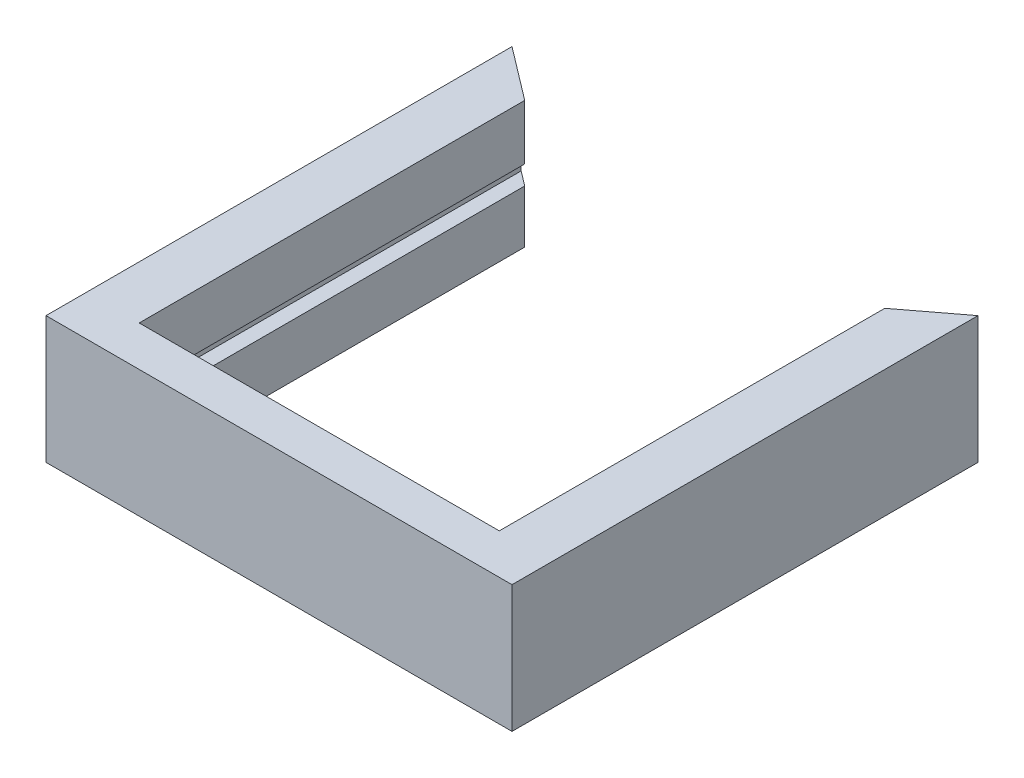
from build123d import *

# Parameters (mm, degrees)
BOSS_EXTRUDE1_DEPTH = 30
SKETCH2_W           = 92
SKETCH2_H           = 5
CUT_EXTRUDE1_DEPTH  = 119.428248319
CHAMFER1_SIZE       = 4


with BuildPart() as part:
    # Sketch1 → Boss-Extrude1 (new body)
    with BuildSketch(Plane(origin=(0, 0, 0), x_dir=(1, 0, 0), z_dir=(0, 1, 0))):
        Polygon((-55, 55), (-42.5, 45.5), (-42.5, -45.5), (42.5, -45.5), (42.5, 45.5), (55, 55), (55, -55), (-55, -55), align=None)
    extrude(amount=BOSS_EXTRUDE1_DEPTH)

    # Sketch2 → Cut-Extrude1 (cut, through all)
    with BuildSketch(Plane(origin=(0, 0, 45.5), x_dir=(-1, 0, 0), z_dir=(0, 0, -1))):
        with Locations((0, 15)):
            Rectangle(SKETCH2_W, SKETCH2_H)
    extrude(amount=CUT_EXTRUDE1_DEPTH, mode=Mode.SUBTRACT)

    # Chamfer1
    # the kernel refuses this chamfer: 4 mm, written as the material it adds along each edge
    with BuildSketch(Plane(origin=(-46, 17.5, 55.786731952), x_dir=(-0.027495876610585623, -0.9996219169112968, 0), z_dir=(0, 0, -1))) as chamfer1_piece_1_section:
        Polygon((CHAMFER1_SIZE * 0.999621916911, -CHAMFER1_SIZE * 0.0274958766106), (-CHAMFER1_SIZE * 0.0274958766106, -CHAMFER1_SIZE * 0.999621916911), (0, 0), align=None)
    chamfer1_piece_1 = extrude(amount=114.233463904, mode=Mode.PRIVATE)
    chamfer1_piece_1 = split(chamfer1_piece_1, bisect_by=Plane(origin=(-22.386376136, 16.144806412, -30.213645864), z_dir=(-0.6050832675335592, 0, 0.7961621941231015)), keep=Keep.TOP, mode=Mode.PRIVATE)
    chamfer1_piece_1 = split(chamfer1_piece_1, bisect_by=Plane(origin=(-42.5, 16.144806412, -0.839947127), z_dir=(-1, 0, 0)), keep=Keep.TOP, mode=Mode.PRIVATE)
    chamfer1_piece_1 = split(chamfer1_piece_1, bisect_by=Plane(origin=(-44.710387176, 16.144806412, 55), z_dir=(0, 0, -1)), keep=Keep.TOP, mode=Mode.PRIVATE)
    add(chamfer1_piece_1)
    with BuildSketch(Plane(origin=(46, 17.5, 55.786731952), x_dir=(-0.9996219169112968, 0.02749587661058651, 0), z_dir=(0, 0, -1))) as chamfer1_piece_2_section:
        Polygon((CHAMFER1_SIZE * 0.999621916911, -CHAMFER1_SIZE * 0.0274958766106), (-CHAMFER1_SIZE * 0.0274958766106, -CHAMFER1_SIZE * 0.999621916911), (0, 0), align=None)
    chamfer1_piece_2 = extrude(amount=114.233463904, mode=Mode.PRIVATE)
    chamfer1_piece_2 = split(chamfer1_piece_2, bisect_by=Plane(origin=(22.386376136, 16.144806412, -30.213645864), z_dir=(0.6050832675335583, 0, 0.7961621941231022)), keep=Keep.TOP, mode=Mode.PRIVATE)
    chamfer1_piece_2 = split(chamfer1_piece_2, bisect_by=Plane(origin=(44.710387176, 16.144806412, 55), z_dir=(0, 0, -1)), keep=Keep.TOP, mode=Mode.PRIVATE)
    chamfer1_piece_2 = split(chamfer1_piece_2, bisect_by=Plane(origin=(42.5, 16.144806412, -0.839947127), z_dir=(1, 0, 0)), keep=Keep.TOP, mode=Mode.PRIVATE)
    add(chamfer1_piece_2)


solid = part.part
